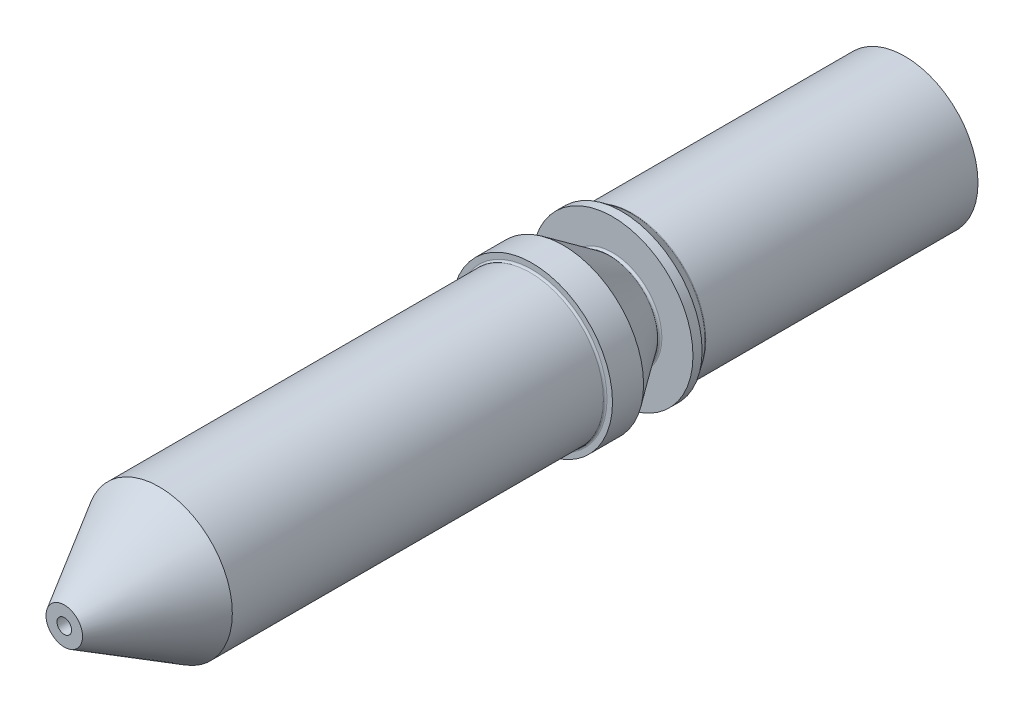
from build123d import *


with BuildPart() as part:
    # Sketch1 → Revolve1 (revolve)
    with BuildSketch(Plane(origin=(0, 0, 0), x_dir=(1, 0, 0), z_dir=(0, 1, 0))):
        with BuildLine():
            Line((0.5, -23), (2, -20.401923789))
            Line((2, -20.401923789), (2, -10.25))
            ThreePointArc((2, -10.25), (2.014644661, -10.214644661), (2.05, -10.2))
            Line((2.05, -10.2), (2.2, -10.2))
            Line((2.2, -10.2), (2.2, -9.349807217))
            Line((2.2, -9.349807217), (1.309042398, -8.077387893))
            ThreePointArc((1.309042398, -8.077387893), (1.305649458, -8.025621641), (1.35, -7.998709071))
            Line((1.35, -7.998709071), (2.2, -7.998709071))
            Line((2.2, -7.998709071), (2.2, -7.748709071))
            Line((2.2, -7.748709071), (2.009042398, -7.475993352))
            ThreePointArc((2.009042398, -7.475993352), (2.002314152, -7.462349821), (2, -7.447314531))
            Line((2, -7.447314531), (2, 0))
            Line((2, 0), (1, 0))
            Line((1, 0), (1, -21.49956969))
            Line((1, -21.49956969), (0.5, -21.8))
            Line((0.5, -21.8), (0.5, -22.419741814))
            Line((0.5, -22.419741814), (0.2, -22.6))
            Line((0.2, -22.6), (0.2, -23))
            Line((0.2, -23), (0.5, -23))
        make_face()
    revolve(axis=Axis((0, 0, 0), (0, 0, 1)))


solid = part.part
